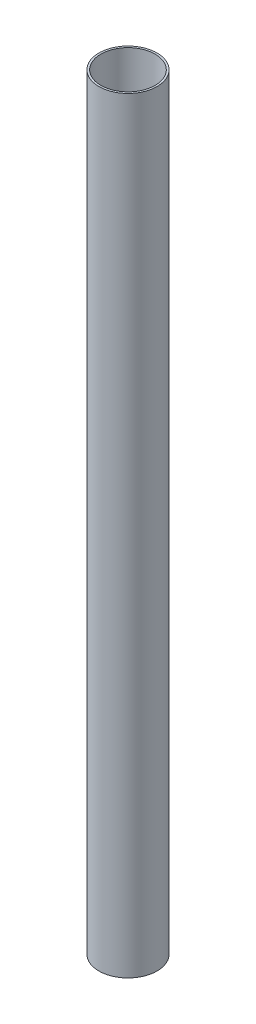
from build123d import *

# Parameters (mm, degrees)
SKETCH1_W = 1.9304
SKETCH1_H = 762


with BuildPart() as part:
    # Sketch1 → Revolve1 (revolve)
    with BuildSketch(Plane.XY):
        with Locations((27.9527, -350.138767116)):
            Rectangle(SKETCH1_W, SKETCH1_H)
    revolve(axis=Axis((0, 0, 0), (0, -1, 0)))


solid = part.part
